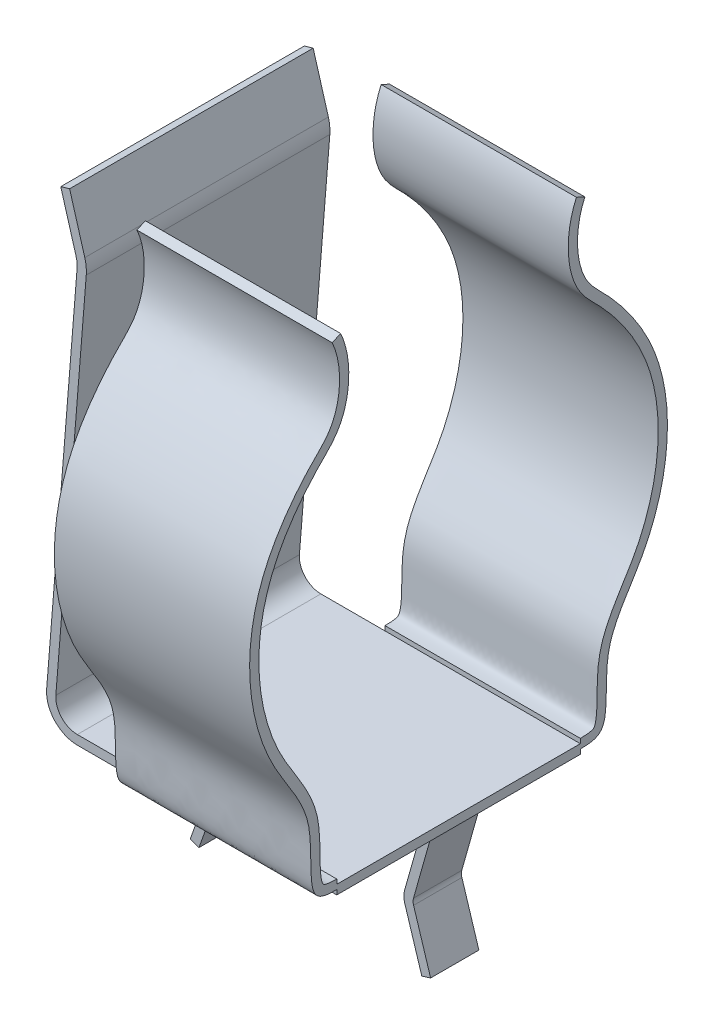
from build123d import *

# Parameters (mm, degrees)
EXTRUDE_THIN2_DEPTH = 3.96
EXTRUDE_THIN3_START = 3.17
EXTRUDE_THIN3_DEPTH = 6.35
EXTRUDE_THIN4_DEPTH = 0.785


# Read off the part's stored shape, not the designer's step: Extrude-Thin3
with BuildPart() as part:
    # Sketch1 → Extrude-Thin2 (new, symmetric)
    with BuildSketch(Plane.XY):
        with BuildLine():
            Line((0.545236742, 15.459459338), (1.038947248, 13.767053852))
            ThreePointArc((1.038947248, 13.767053852), (1.073775143, 13.588718189), (1.075757677, 13.407024325))
            Line((1.075757677, 13.407024325), (0.086655932, 1.079981308))
            ThreePointArc((0.086655932, 1.079981308), (0.348611732, 0.321760112), (1.083452295, 0))
            Line((1.083452295, 0), (9.52, 0))
            Line((9.52, 0), (9.52, 0.3))
            Line((9.52, 0.3), (1.083452295, 0.3))
            ThreePointArc((1.083452295, 0.3), (0.569063901, 0.525232078), (0.385694841, 1.055986916))
            Line((0.385694841, 1.055986916), (1.374796586, 13.383029933))
            ThreePointArc((1.374796586, 13.383029933), (1.372219292, 13.619231956), (1.326943029, 13.851068317))
            Line((1.326943029, 13.851068317), (0.833232523, 15.543473804))
            Line((0.833232523, 15.543473804), (0.545236742, 15.459459338))
        make_face()
    extrude(amount=EXTRUDE_THIN2_DEPTH, both=True)

    # Extrude-Thin3 outline → Extrude-Thin3 (add)
    with BuildSketch(Plane(origin=(0, 0, 0), x_dir=(0, 0, -1), z_dir=(1, 0, 0)).offset(EXTRUDE_THIN3_START)):
        with BuildLine():
            Line((-3.96, 0.3), (-3.96, 0.45))
            add(Edge.make_bspline(
                [(-3.96, 0.45), (-4.040580754, 0.45), (-4.121765505, 0.452309096), (-4.260964392, 0.467038084), (-4.316737316, 0.480041312), (-4.378047063, 0.505146816), (-4.386730648, 0.511965337), (-4.417436363, 0.552560186), (-4.439517488, 0.592972058), (-4.477075557, 0.772134489), (-4.489910295, 0.901005725), (-4.503425293, 1.180385544), (-4.504946162, 1.331722032), (-4.508298665, 1.620690566), (-4.511063033, 1.755839767), (-4.522422967, 1.996575152), (-4.530637121, 2.104976406), (-4.564690638, 2.407505843), (-4.600670881, 2.579770397), (-4.700672174, 2.913053607), (-4.763799844, 3.071720134), (-4.977197484, 3.529397656), (-5.150928177, 3.810406001), (-5.494127367, 4.362035772), (-5.661930244, 4.630775265), (-5.947083051, 5.198160276), (-6.069618664, 5.49811702), (-6.370869125, 6.430761169), (-6.483394296, 7.095237692), (-6.500746159, 8.429811714), (-6.405403076, 9.101323028), (-6.082352555, 10.070204868), (-5.943391087, 10.386731211), (-5.607242596, 11.003612473), (-5.412005652, 11.302594317), (-4.990297168, 11.864927164), (-4.763828786, 12.128294528), (-4.418864894, 12.484555257), (-4.296439742, 12.599897745), (-4.112942168, 12.80496087), (-4.052413739, 12.878392585), (-3.983392003, 12.976305464), (-3.971589476, 12.993652948), (-3.96, 13.011299188)],
                knots=[0, 0, 0, 0, 0.015625, 0.015625, 0.03125, 0.03125, 0.046875, 0.046875, 0.0625, 0.0625, 0.078125, 0.078125, 0.09375, 0.09375, 0.109375, 0.109375, 0.125, 0.125, 0.15625, 0.15625, 0.1875, 0.1875, 0.25, 0.25, 0.3125, 0.3125, 0.375, 0.375, 0.5, 0.5, 0.625, 0.625, 0.6875, 0.6875, 0.75, 0.75, 0.8125, 0.8125, 0.84375, 0.84375, 0.859375, 0.859375, 0.86265965, 0.86265965, 0.86265965, 0.86265965], degree=3))
            Line((-3.96, 13.011299188), (-3.96, 13.751086361))
            add(Edge.make_bspline(
                [(-3.96, 0.15), (-4.086926117, 0.15), (-4.436839478, 0.162174886), (-4.816816776, 0.402341381), (-4.792213263, 1.853948665), (-4.939834343, 3.108727843), (-6.095007993, 4.50260481), (-6.971075592, 7.187454434), (-6.679433648, 10.155316707), (-5.138740924, 12.237511974), (-4.202617904, 13.100491841), (-4.014849512, 13.547191012), (-3.96, 13.751086361)],
                knots=[0, 0, 0, 0, 0.023143707, 0.058650764, 0.098798342, 0.151078469, 0.301850895, 0.445937068, 0.657113288, 0.816183386, 0.864172729, 0.899191604, 0.899191604, 0.899191604, 0.899191604], degree=3))
            Line((-3.96, 0.15), (-3.96, 0.3))
        make_face()
        with BuildLine():
            Line((-3.96, 13.751086361), (-3.96, 13.011299188))
            add(Edge.make_bspline(
                [(-3.96, 13.011299188), (-3.916458619, 13.077595686), (-3.875924423, 13.14810909), (-3.656806847, 13.588128174), (-3.569816142, 14.019895953), (-3.566830977, 14.899607362), (-3.651558976, 15.348698938), (-3.83485804, 15.749068293)],
                knots=[0.86265965, 0.86265965, 0.86265965, 0.86265965, 0.875, 0.875, 0.9375, 0.9375, 1, 1, 1, 1], degree=3))
            Line((-3.83485804, 15.749068293), (-4.107629991, 15.6241865))
            add(Edge.make_bspline(
                [(-3.96, 15.204711157), (-3.997521409, 15.350052807), (-4.046665557, 15.491025474), (-4.107629991, 15.6241865)],
                knots=[0.976499261, 0.976499261, 0.976499261, 0.976499261, 1, 1, 1, 1], degree=3))
            add(Edge.make_bspline(
                [(-3.96, 13.751086361), (-3.838914237, 14.201205661), (-3.836570175, 14.726597588), (-3.96, 15.204711157)],
                knots=[0.899191604, 0.899191604, 0.899191604, 0.899191604, 0.976499261, 0.976499261, 0.976499261, 0.976499261], degree=3))
        make_face()
    extrude_thin3 = extrude(amount=EXTRUDE_THIN3_DEPTH)

    # Sketch3 → Extrude-Thin4 (add, symmetric)
    with BuildSketch(Plane.XY):
        with BuildLine():
            Line((1.579598304, -0.04597427), (2.210420009, -2.005097261))
            ThreePointArc((2.210420009, -2.005097261), (2.227221022, -2.117901764), (2.206863447, -2.230118959))
            Line((2.206863447, -2.230118959), (1.581122545, -3.981679033))
            Line((1.581122545, -3.981679033), (1.86363573, -4.082606234))
            Line((1.86363573, -4.082606234), (2.489376633, -2.33104616))
            ThreePointArc((2.489376633, -2.33104616), (2.527183557, -2.122642797), (2.495981677, -1.913148721))
            Line((2.495981677, -1.913148721), (1.865159971, 0.04597427))
            Line((1.865159971, 0.04597427), (1.579598304, -0.04597427))
        make_face()
        with BuildLine():
            Line((9.109096534, 0.040689817), (8.551718875, -1.93699863))
            ThreePointArc((8.551718875, -1.93699863), (8.527412159, -2.122535234), (8.556968719, -2.307308223))
            Line((8.556968719, -2.307308223), (9.110308036, -4.076908876))
            Line((9.110308036, -4.076908876), (9.396636404, -3.987376391))
            Line((9.396636404, -3.987376391), (8.843297086, -2.217775738))
            ThreePointArc((8.843297086, -2.217775738), (8.827382016, -2.11828259), (8.840470248, -2.018378265))
            Line((8.840470248, -2.018378265), (9.397847906, -0.040689817))
            Line((9.397847906, -0.040689817), (9.109096534, 0.040689817))
        make_face()
    extrude(amount=EXTRUDE_THIN4_DEPTH, both=True)

    # Mirror1: Extrude-Thin3 across plane
    add(extrude_thin3.mirror(Plane.XY))


solid = part.part
